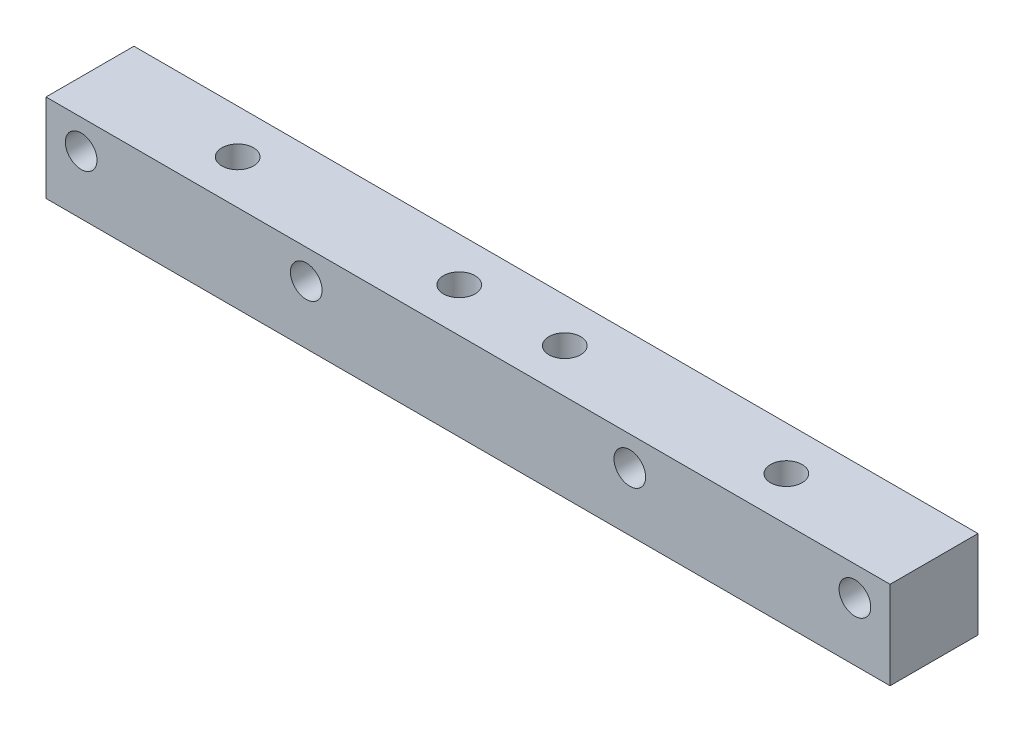
from build123d import *

# Parameters (mm, degrees)
SKETCH1_W             = 12.5
SKETCH1_H             = 12.5
BOSS_EXTRUDE1_DEPTH   = 60
F_4_0MM_DOWEL_HOLE1_D = 4.5
F_1_0MM_DOWEL_HOLE1_D = 4.5


with BuildPart() as part:
    # Sketch1 → Boss-Extrude1 (new, symmetric)
    with BuildSketch(Plane(origin=(0, 0, 0), x_dir=(0, 0, -1), z_dir=(1, 0, 0))):
        Rectangle(SKETCH1_W, SKETCH1_H)
    extrude(amount=BOSS_EXTRUDE1_DEPTH, both=True)

    # Ø4.0mm Dowel Hole1 (through all)
    with Locations(Plane.XY.offset(6.25)):
        with Locations((-55, 2.07), (-23, 2.07), (23, 2.07), (55, 2.07)):
            Hole(F_4_0MM_DOWEL_HOLE1_D / 2)

    # Ø1.0mm Dowel Hole1 (through all)
    with Locations(Plane(origin=(0, 6.25, 0), x_dir=(1, 0, 0), z_dir=(0, 1, 0))):
        with Locations((-39, 0), (39, 0), (-7.5, 0), (7.5, 0)):
            Hole(F_1_0MM_DOWEL_HOLE1_D / 2)


solid = part.part
